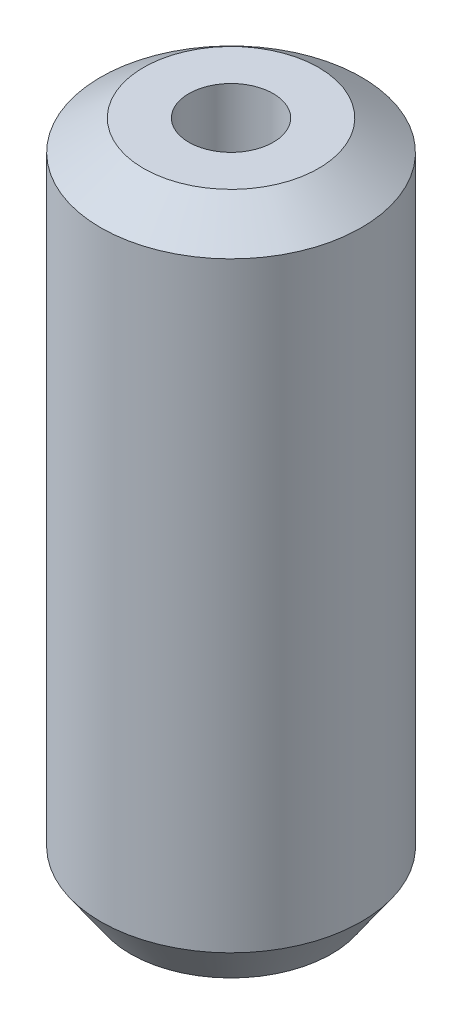
from build123d import *
from OCP.BRepFilletAPI import BRepFilletAPI_MakeChamfer

# Parameters (mm, degrees)
SKETCH1_R           = 7.5
BOSS_EXTRUDE1_DEPTH = 38.749428218
SKETCH2_R           = 2.427536766
CUT_EXTRUDE1_DEPTH  = 41.174845204
CHAMFER1_SIZE       = 1.716796155
CHAMFER1_SIZE2      = 2.465968802


with BuildPart() as part:
    # Sketch1 → Boss-Extrude1 (new body)
    with BuildSketch(Plane(origin=(0, 0, 0), x_dir=(1, 0, 0), z_dir=(0, 1, 0))):
        Circle(SKETCH1_R)
    extrude(amount=BOSS_EXTRUDE1_DEPTH)

    # Sketch2 → Cut-Extrude1 (cut, through all)
    with BuildSketch(Plane(origin=(0, 0, 0), x_dir=(1, 0, 0), z_dir=(0, 1, 0))):
        Circle(SKETCH2_R)
    extrude(amount=CUT_EXTRUDE1_DEPTH, mode=Mode.SUBTRACT)

    # Chamfer1: one chamfer whose edges measure the first distance from different faces: ONE call of the kernel's chamfer builder (chamfer() names one face for all edges)
    chamfer1_edges_1 = [part.edges().sort_by_distance(p)[0] for p in [
        (-7.5, 38.749428218, 0),
    ]]
    chamfer1_side_1 = [part.faces().sort_by_distance(p)[0] for p in [
        (-7.5, 19.374714109, 0),
    ]]
    chamfer1_edges_2 = [part.edges().sort_by_distance(p)[0] for p in [
        (-7.5, 0, 0),
    ]]
    chamfer1_side_2 = [part.faces().sort_by_distance(p)[0] for p in [
        (-7.287867966, 0, 0),
    ]]
    chamfer1 = BRepFilletAPI_MakeChamfer(part.part.solid().wrapped)
    for e in chamfer1_edges_1:
        chamfer1.Add(CHAMFER1_SIZE, CHAMFER1_SIZE2, e.wrapped, chamfer1_side_1[0].wrapped)  # the first distance lies on this face
    for e in chamfer1_edges_2:
        chamfer1.Add(CHAMFER1_SIZE, CHAMFER1_SIZE2, e.wrapped, chamfer1_side_2[0].wrapped)  # the first distance lies on this face
    add(Compound.cast(chamfer1.Shape()), mode=Mode.REPLACE)


solid = part.part
